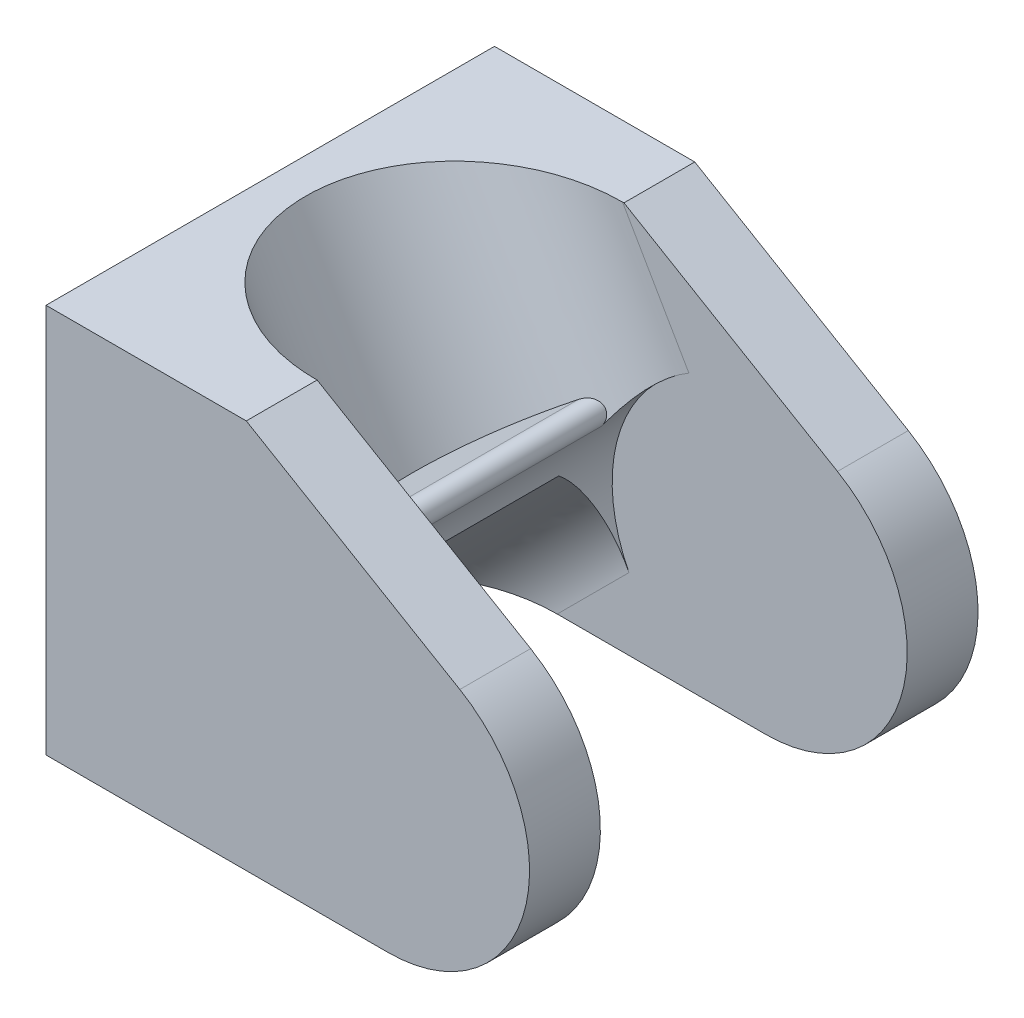
from build123d import *

# Parameters (mm, degrees)
EXTRUDE_1_DEPTH          = 9.5
CUT_EXTRUDE_1_DEPTH      = 19.754173631
CUT_EXTRUDE_1_DEPTH_BACK = 19.754173631
CUT_EXTRUDE_3_DEPTH      = 18.322626316
CUT_EXTRUDE_3_DEPTH_BACK = 18.322626316
SKETCH_5_R               = 6.5
CUT_EXTRUDE_4_DEPTH      = 6.5
EXTRUDE_2_DEPTH          = 6.5


with BuildPart() as part:
    # Эскиз2 → Бобышка-Вытянуть1 (new, symmetric)
    with BuildSketch(Plane.XY):
        with BuildLine():
            Line((3.046153846, 5.169230769), (-6, 10.5))
            Line((-6, 10.5), (-14.485281374, 10.5))
            Line((-14.485281374, 10.5), (-14.485281374, -6))
            Line((-14.485281374, -6), (0, -6))
            ThreePointArc((0, -6), (5.788582927, -1.578704435), (3.046153846, 5.169230769))
        make_face()
    extrude(amount=EXTRUDE_1_DEPTH, both=True)

    # Эскиз3 → Вырез-Вытянуть1 (cut, two sides: drawn at the far end of the back side and taken through both)
    with BuildSketch(Plane(origin=(-3.249999973, 5.629165078, 0), x_dir=(0.8660254037844386, 0.4999999999999999, 0), z_dir=(-0.49999999999999994, 0.8660254037844387, 0)).offset(-CUT_EXTRUDE_1_DEPTH_BACK)):
        with BuildLine():
            Line((0, 6.5), (6, 6.5))
            Line((6, 6.5), (6, -6.5))
            Line((6, -6.5), (0, -6.5))
            add(Edge.make_bspline(
                [(0, 6.5), (-6, 6.5), (-6, 0), (-6, -6.5), (0, -6.5)],
                knots=[0, 0, 0, 1.570796327, 1.570796327, 3.141592654, 3.141592654, 3.141592654], degree=2, weights=[1, 0.707106781, 1, 0.707106781, 1]))
        make_face()
    extrude(amount=CUT_EXTRUDE_1_DEPTH + CUT_EXTRUDE_1_DEPTH_BACK, mode=Mode.SUBTRACT)

    # Эскиз4 → Вырез-Вытянуть3 (cut, two sides: drawn at the far end of the back side and taken through both)
    with BuildSketch(Plane(origin=(-4.242640687, 4.242640687, 0), x_dir=(-0.7071067811865511, 0.707106781186544, 0), z_dir=(-0.707106781186544, -0.7071067811865511, 0)).offset(-CUT_EXTRUDE_3_DEPTH_BACK)):
        with BuildLine():
            Line((-12, -6.5), (-4, -6.5))
            add(Edge.make_bspline(
                [(-4, -6.5), (0, -6.5), (0, -2)],
                knots=[0, 0, 0, 1.570796327, 1.570796327, 1.570796327], degree=2, weights=[1, 0.707106781, 1]))
            Line((0, -2), (0, 2))
            add(Edge.make_bspline(
                [(0, 2), (0, 6.5), (-4, 6.5)],
                knots=[4.71238898, 4.71238898, 4.71238898, 6.283185307, 6.283185307, 6.283185307], degree=2, weights=[1, 0.707106781, 1]))
            Line((-4, 6.5), (-12, 6.5))
            Line((-12, 6.5), (-12, -6.5))
        make_face()
    extrude(amount=CUT_EXTRUDE_3_DEPTH + CUT_EXTRUDE_3_DEPTH_BACK, mode=Mode.SUBTRACT)

    # Эскиз5 → Вырез-Вытянуть4 (cut, symmetric)
    with BuildSketch(Plane.XY):
        Circle(SKETCH_5_R)
    extrude(amount=CUT_EXTRUDE_4_DEPTH, both=True, mode=Mode.SUBTRACT)

    # Эскиз6 → Бобышка-Вытянуть2 (add, symmetric)
    with BuildSketch(Plane.XY):
        with BuildLine():
            Line((-6.502520338, 3.75132157), (-8.445640507, 2.629460617))
            Line((-8.445640507, 2.629460617), (-8.980852778, -0.495571404))
            ThreePointArc((-8.980852778, -0.495571404), (-7.713770339, 0.615313333), (-6.312263919, 1.550910769))
            ThreePointArc((-6.312263919, 1.550910769), (-6.076847823, 2.306928809), (-5.751252167, 3.028712353))
            ThreePointArc((-5.751252167, 3.028712353), (-5.855186593, 3.672492332), (-6.502520338, 3.75132157))
        make_face()
    extrude(amount=EXTRUDE_2_DEPTH, both=True)


solid = part.part
